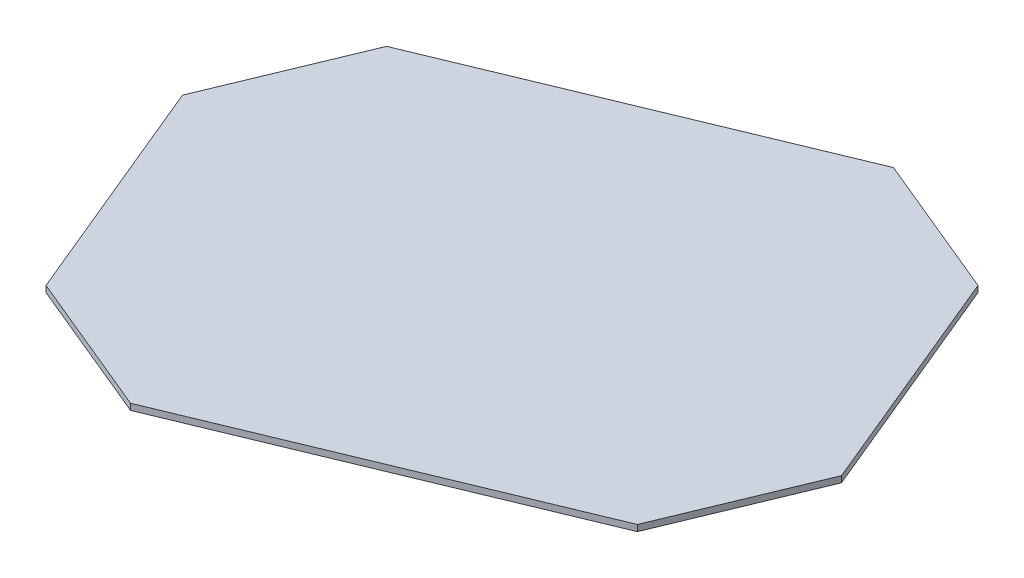
from build123d import *

# Parameters (mm, degrees)
BOSS_EXTRUDE1_DEPTH = 3


with BuildPart() as part:
    # Sketch1 → Boss-Extrude1 (new body)
    with BuildSketch(Plane(origin=(0, 0, 0), x_dir=(1, 0, 0), z_dir=(0, 1, 0))):
        Polygon((112.306795972, 112.306795972), (42.738667174, 141.122858429), (-130.009731553, 69.568128798), (-158.82579401, 0), (-112.306795972, -112.306795972), (-42.738667174, -141.122858429), (130.009731553, -69.568128798), (158.82579401, 0), align=None)
    extrude(amount=BOSS_EXTRUDE1_DEPTH)


solid = part.part
